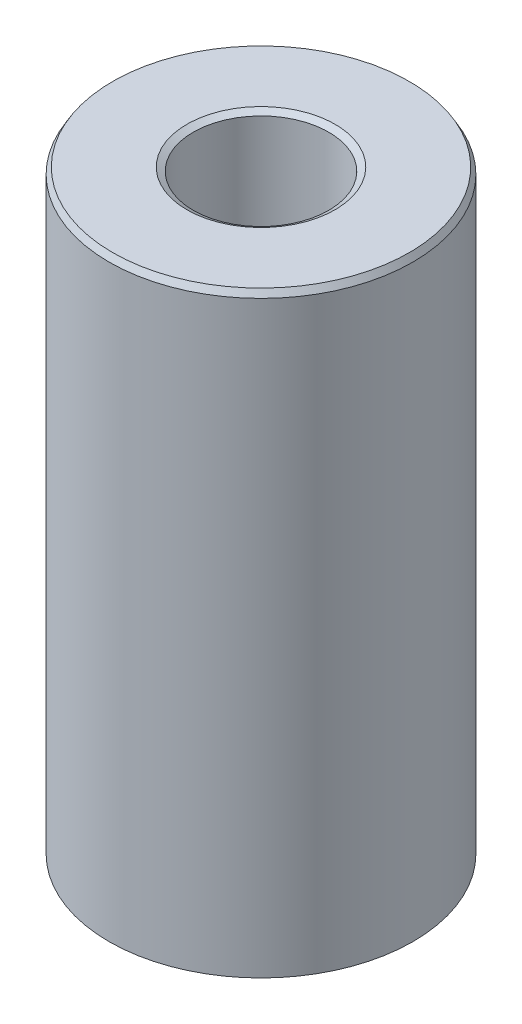
from build123d import *
from OCP.BRepFilletAPI import BRepFilletAPI_MakeChamfer

# Parameters (mm, degrees)
SKETCH1_R           = 5
BOSS_EXTRUDE1_DEPTH = 19.694208674
SKETCH2_R           = 2.229343107
CUT_EXTRUDE1_DEPTH  = 21.925148872
CHAMFER1_SIZE       = 0.208759194
CHAMFER1_SIZE2      = 0.120527177


with BuildPart() as part:
    # Sketch1 → Boss-Extrude1 (new body)
    with BuildSketch(Plane(origin=(0, 0, 0), x_dir=(1, 0, 0), z_dir=(0, 1, 0))):
        Circle(SKETCH1_R)
    extrude(amount=BOSS_EXTRUDE1_DEPTH)

    # Sketch2 → Cut-Extrude1 (cut, through all)
    with BuildSketch(Plane(origin=(0, 0, 0), x_dir=(1, 0, 0), z_dir=(0, 1, 0))):
        Circle(SKETCH2_R)
    extrude(amount=CUT_EXTRUDE1_DEPTH, mode=Mode.SUBTRACT)

    # Chamfer1: one chamfer whose edges measure the first distance from different faces: ONE call of the kernel's chamfer builder (chamfer() names one face for all edges)
    chamfer1_edges_1 = [part.edges().sort_by_distance(p)[0] for p in [
        (-2.229343107, 19.694208674, 0),
    ]]
    chamfer1_side_1 = [part.faces().sort_by_distance(p)[0] for p in [
        (-4.858578644, 19.694208674, 0),
    ]]
    chamfer1_edges_2 = [part.edges().sort_by_distance(p)[0] for p in [
        (-2.229343107, 0, 0),
    ]]
    chamfer1_side_2 = [part.faces().sort_by_distance(p)[0] for p in [
        (-2.229343107, 9.847104337, 0),
    ]]
    chamfer1_edges_3 = [part.edges().sort_by_distance(p)[0] for p in [
        (-5, 0, 0),
    ]]
    chamfer1_side_3 = [part.faces().sort_by_distance(p)[0] for p in [
        (-4.858578644, 0, 0),
    ]]
    chamfer1_edges_4 = [part.edges().sort_by_distance(p)[0] for p in [
        (-5, 19.694208674, 0),
    ]]
    chamfer1_side_4 = [part.faces().sort_by_distance(p)[0] for p in [
        (-5, 9.847104337, 0),
    ]]
    chamfer1 = BRepFilletAPI_MakeChamfer(part.part.solid().wrapped)
    for e in chamfer1_edges_1:
        chamfer1.Add(CHAMFER1_SIZE, CHAMFER1_SIZE2, e.wrapped, chamfer1_side_1[0].wrapped)  # the first distance lies on this face
    for e in chamfer1_edges_2:
        chamfer1.Add(CHAMFER1_SIZE, CHAMFER1_SIZE2, e.wrapped, chamfer1_side_2[0].wrapped)  # the first distance lies on this face
    for e in chamfer1_edges_3:
        chamfer1.Add(CHAMFER1_SIZE, CHAMFER1_SIZE2, e.wrapped, chamfer1_side_3[0].wrapped)  # the first distance lies on this face
    for e in chamfer1_edges_4:
        chamfer1.Add(CHAMFER1_SIZE, CHAMFER1_SIZE2, e.wrapped, chamfer1_side_4[0].wrapped)  # the first distance lies on this face
    add(Compound.cast(chamfer1.Shape()), mode=Mode.REPLACE)


solid = part.part
